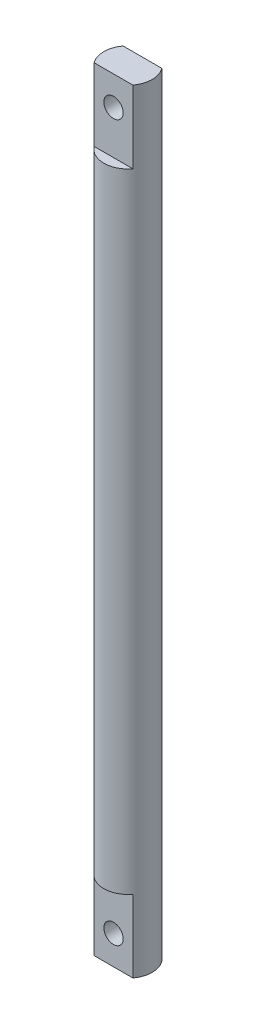
from build123d import *

# Parameters (mm, degrees)
SKETCH1_R           = 5
BOSS_EXTRUDE1_DEPTH = 80
CUT_EXTRUDE1_DEPTH  = 15
SKETCH3_R           = 2
CUT_EXTRUDE2_DEPTH  = 81.554329493


with BuildPart() as part:
    # Sketch1 → Boss-Extrude1 (new, symmetric)
    with BuildSketch(Plane(origin=(0, 0, 0), x_dir=(1, 0, 0), z_dir=(0, 1, 0))):
        Circle(SKETCH1_R)
    extrude(amount=BOSS_EXTRUDE1_DEPTH, both=True)

    # Sketch2 → Cut-Extrude1 (cut)
    with BuildSketch(Plane(origin=(0, 80, 0), x_dir=(1, 0, 0), z_dir=(0, 1, 0))):
        with BuildLine():
            Line((-4, -3), (4, -3))
            ThreePointArc((4, -3), (0, -5), (-4, -3))
        make_face()
        with BuildLine():
            Line((-4, 3), (4, 3))
            ThreePointArc((4, 3), (0, 5), (-4, 3))
        make_face()
    cut_extrude1 = extrude(amount=-CUT_EXTRUDE1_DEPTH, mode=Mode.SUBTRACT)

    # Mirror2: Cut-Extrude1 across plane
    add(cut_extrude1.mirror(Plane.ZX), mode=Mode.SUBTRACT)

    # Sketch3 → Cut-Extrude2 (cut, through all)
    with BuildSketch(Plane.XY.offset(3)):
        with Locations((0, 74)):
            Circle(SKETCH3_R)
    cut_extrude2 = extrude(amount=-CUT_EXTRUDE2_DEPTH, mode=Mode.SUBTRACT)

    # Mirror3: Cut-Extrude2 across plane
    add(cut_extrude2.mirror(Plane.ZX), mode=Mode.SUBTRACT)


solid = part.part
